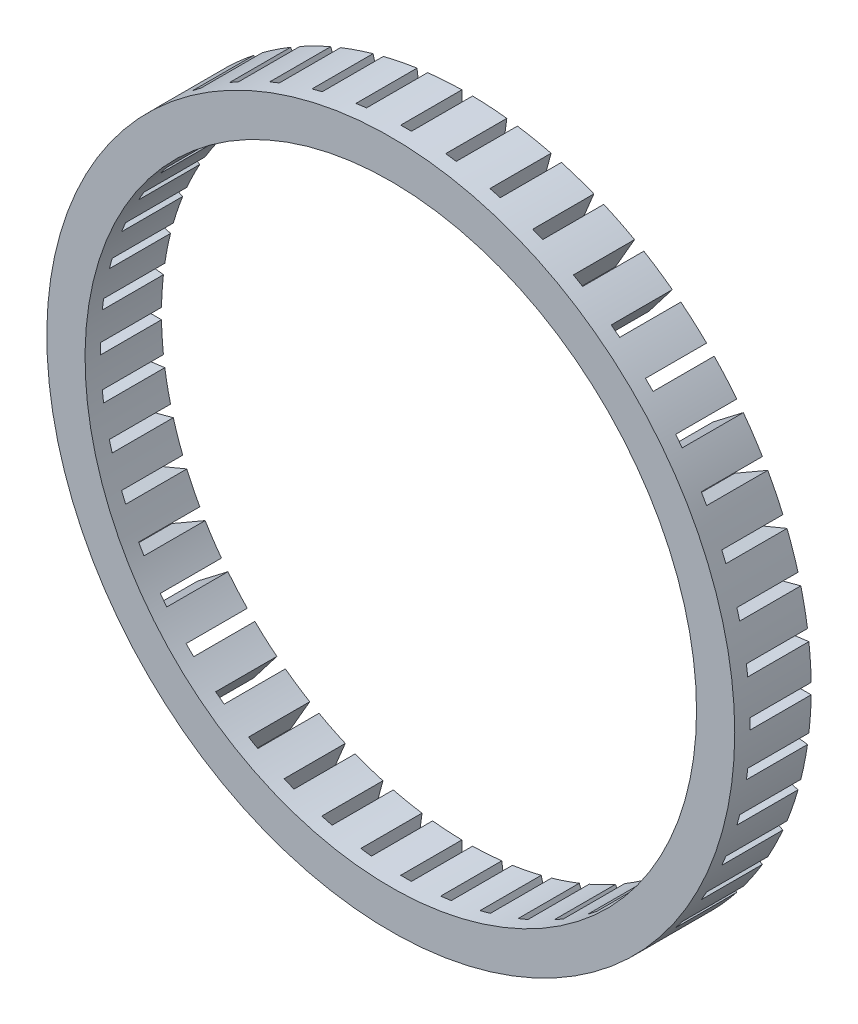
from build123d import *

# Parameters (mm, degrees)
SKETCH1_R           = 45
SKETCH1_R_2         = 40
BOSS_EXTRUDE1_DEPTH = 10
SKETCH3_W           = 1.4
SKETCH3_H           = 8
CUT_EXTRUDE1_DEPTH  = 65.420493634
CIRPATTERN1_COUNT   = 48


with BuildPart() as part:
    # Sketch1 → Boss-Extrude1 (new body)
    with BuildSketch(Plane.XY):
        Circle(SKETCH1_R)
        Circle(SKETCH1_R_2, mode=Mode.SUBTRACT)
    extrude(amount=BOSS_EXTRUDE1_DEPTH)

    # Sketch3 → Cut-Extrude1 (cut, symmetric)
    with BuildSketch(Plane(origin=(0, 0, 0), x_dir=(1, 0, 0), z_dir=(0, 1, 0))):
        with Locations((0, -4)):
            Rectangle(SKETCH3_W, SKETCH3_H)
    cut_extrude1 = extrude(amount=CUT_EXTRUDE1_DEPTH, both=True, mode=Mode.SUBTRACT)

    # CirPattern1: Cut-Extrude1 ×48 about axis
    cirpattern1_axis = Axis((0, 0, -0.5), (0, 0, 1))
    for i in range(1, CIRPATTERN1_COUNT):
        add(cut_extrude1.rotate(cirpattern1_axis, i * 360 / CIRPATTERN1_COUNT), mode=Mode.SUBTRACT)


solid = part.part
